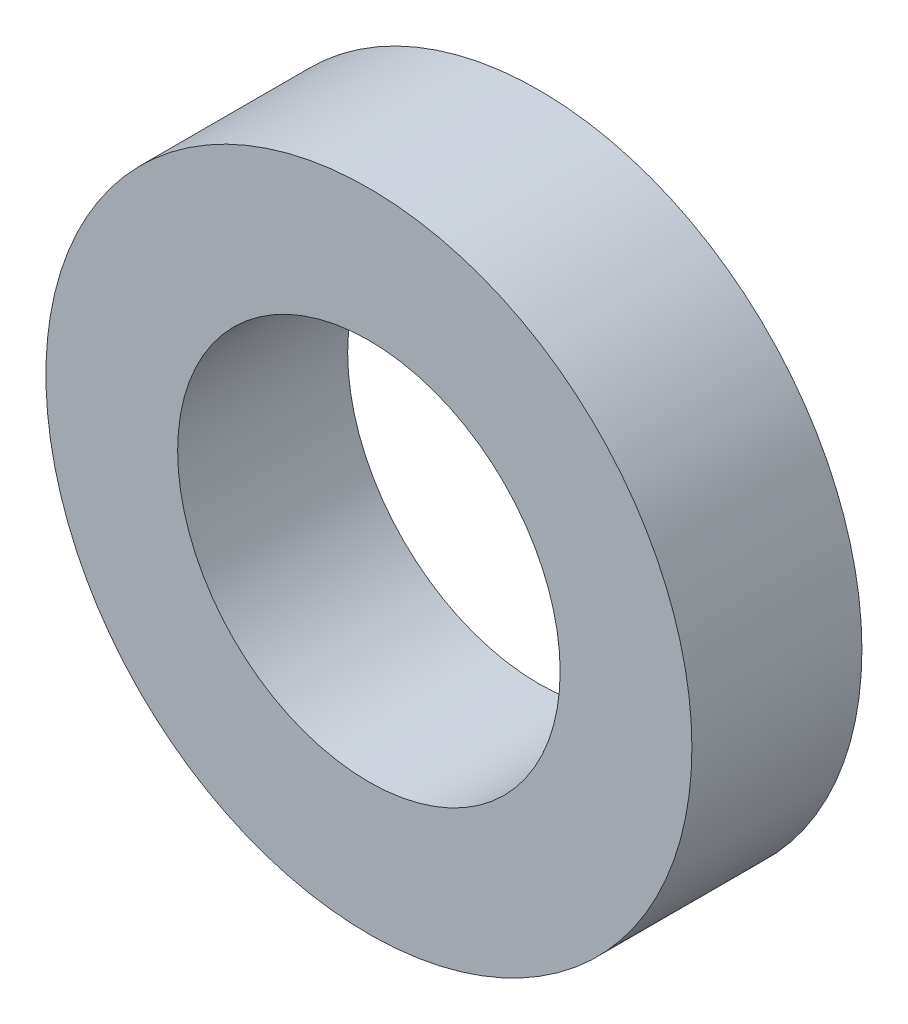
from build123d import *

# Parameters (mm, degrees)
SKETCH1_R           = 24.13
SKETCH1_R_2         = 14.2875
BOSS_EXTRUDE1_DEPTH = 6.35


with BuildPart() as part:
    # Sketch1 → Boss-Extrude1 (new, symmetric)
    with BuildSketch(Plane.XY):
        Circle(SKETCH1_R)
        Circle(SKETCH1_R_2, mode=Mode.SUBTRACT)
    extrude(amount=BOSS_EXTRUDE1_DEPTH, both=True)


solid = part.part
